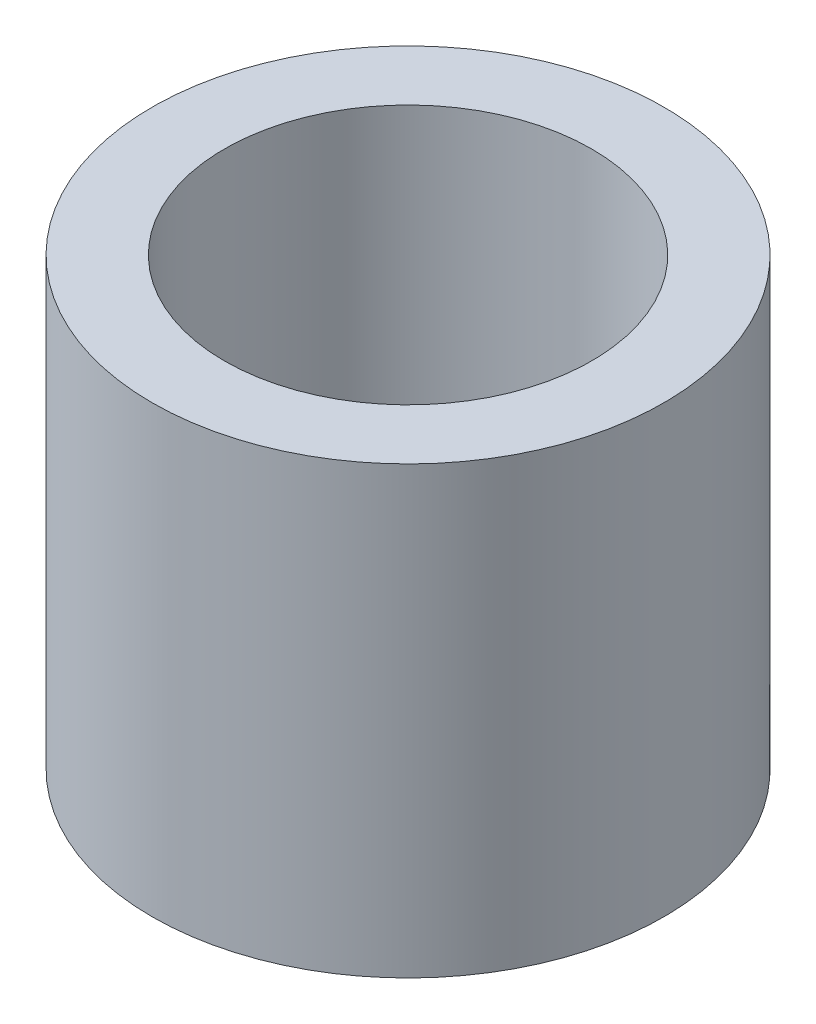
from build123d import *

# Parameters (mm, degrees)
SKETCH_1_R      = 23
EXTRUDE_1_DEPTH = 5
SKETCH_2_R      = 23
SKETCH_2_R_2    = 16.5
EXTRUDE_2_DEPTH = 35


with BuildPart() as part:
    # Эскиз1 → Бобышка-Вытянуть1 (new body)
    with BuildSketch(Plane(origin=(0, 0, 0), x_dir=(1, 0, 0), z_dir=(0, 1, 0))):
        Circle(SKETCH_1_R)
    extrude(amount=EXTRUDE_1_DEPTH)

    # Эскиз2 → Бобышка-Вытянуть2 (add)
    with BuildSketch(Plane(origin=(0, 5, 0), x_dir=(1, 0, 0), z_dir=(0, 1, 0))):
        Circle(SKETCH_2_R)
        Circle(SKETCH_2_R_2, mode=Mode.SUBTRACT)
    extrude(amount=EXTRUDE_2_DEPTH)


solid = part.part
